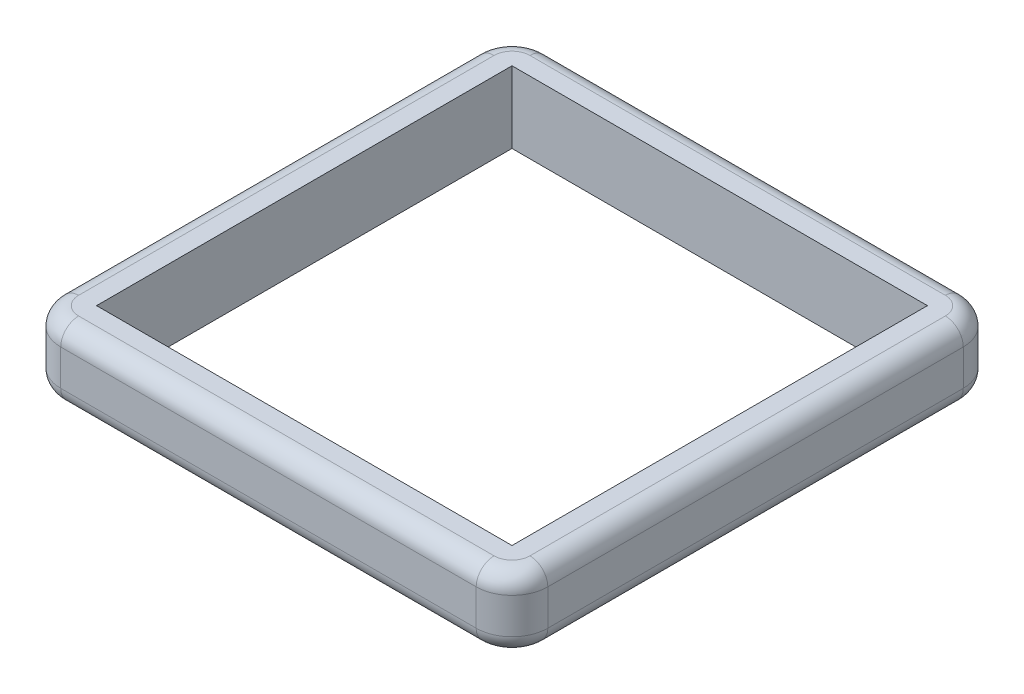
from build123d import *

# Parameters (mm, degrees)
BOSS_EXTRUDE1_DEPTH = 736.6
REVOLVE13_ANGLE     = 90
REVOLVE12_ANGLE     = 90
BOSS_EXTRUDE3_DEPTH = 736.6
REVOLVE2_ANGLE      = 90
BOSS_EXTRUDE4_DEPTH = 736.6
REVOLVE10_ANGLE     = 90
BOSS_EXTRUDE5_DEPTH = 736.6


with BuildPart() as part:
    # Sketch1 → Boss-Extrude1 (new body)
    with BuildSketch(Plane(origin=(0, 0, 0), x_dir=(0, 0, -1), z_dir=(1, 0, 0))):
        with BuildLine():
            ThreePointArc((0, 31.75), (-22.450640303, 22.450640303), (-31.75, 0))
            Line((-31.75, 0), (-31.75, -63.5))
            ThreePointArc((-31.75, -63.5), (-22.450640303, -85.950640303), (0, -95.25))
            Line((0, -95.25), (31.75, -95.25))
            Line((31.75, -95.25), (31.75, 0))
            Line((31.75, 0), (31.75, 31.75))
            Line((31.75, 31.75), (0, 31.75))
        make_face()
    extrude(amount=BOSS_EXTRUDE1_DEPTH)



with BuildPart() as body_2:
    # Sketch8 → Revolve13 (revolve)
    with BuildSketch(Plane(origin=(736.6, 0, 0), x_dir=(0, 0, -1), z_dir=(1, 0, 0))):
        with BuildLine():
            Line((-31.75, 0), (-31.75, -63.5))
            ThreePointArc((-31.75, -63.5), (-22.450640303, -85.950640303), (0, -95.25))
            Line((0, -95.25), (31.75, -95.25))
            Line((31.75, -95.25), (31.75, 31.75))
            Line((31.75, 31.75), (0, 31.75))
            ThreePointArc((0, 31.75), (-22.450640303, 22.450640303), (-31.75, 0))
        make_face()
    revolve(axis=Axis((736.6, -95.25, -31.75), (0, 1, 0)), revolution_arc=REVOLVE13_ANGLE)


with BuildPart() as body_3:
    # Sketch15 → Revolve12 (revolve)
    with BuildSketch(Plane(origin=(0, 0, -31.75), x_dir=(0, 0, 1), z_dir=(-1, 0, 0))):
        with BuildLine():
            ThreePointArc((31.75, -95.25), (54.200640303, -85.950640303), (63.5, -63.5))
            Line((63.5, -63.5), (63.5, 0))
            ThreePointArc((63.5, 0), (54.200640303, 22.450640303), (31.75, 31.75))
            Line((31.75, 31.75), (0, 31.75))
            Line((0, 31.75), (0, -95.25))
            Line((0, -95.25), (31.75, -95.25))
        make_face()
    revolve(axis=Axis((0, 31.75, -31.75), (0, -1, 0)), revolution_arc=REVOLVE12_ANGLE)


with BuildPart() as part_1:
    add(part.part)

    add(body_2.part)  # Boss-Extrude3 merges body 2
    # Sketch7 → Boss-Extrude3 (add)
    with BuildSketch(Plane(origin=(0, 0, -31.75), x_dir=(-1, 0, 0), z_dir=(0, 0, -1))):
        with BuildLine():
            ThreePointArc((-768.35, 31.75), (-790.800640303, 22.450640303), (-800.1, 0))
            Line((-800.1, 0), (-800.1, -63.5))
            ThreePointArc((-800.1, -63.5), (-790.800640303, -85.950640303), (-768.35, -95.25))
            Line((-768.35, -95.25), (-736.6, -95.25))
            Line((-736.6, -95.25), (-736.6, 31.75))
            Line((-736.6, 31.75), (-768.35, 31.75))
        make_face()
    extrude(amount=BOSS_EXTRUDE3_DEPTH)

    # Sketch12 → Revolve2 (revolve)
    with BuildSketch(Plane(origin=(1454.15, 0, -768.35), x_dir=(-1, 0, 0), z_dir=(0, 0, -1))):
        with BuildLine():
            ThreePointArc((685.8, 31.75), (663.349359697, 22.450640303), (654.05, 0))
            Line((654.05, 0), (654.05, -63.5))
            ThreePointArc((654.05, -63.5), (663.349359697, -85.950640303), (685.8, -95.25))
            Line((685.8, -95.25), (717.55, -95.25))
            Line((717.55, -95.25), (717.55, 31.75))
            Line((717.55, 31.75), (685.8, 31.75))
        make_face()
    revolve(axis=Axis((736.6, -95.25, -768.35), (0, 1, 0)), revolution_arc=REVOLVE2_ANGLE)


    add(body_3.part)  # Boss-Extrude4 merges body 3
    # Sketch9 → Boss-Extrude4 (add)
    with BuildSketch(Plane(origin=(0, 0, -31.75), x_dir=(-1, 0, 0), z_dir=(0, 0, -1))):
        with BuildLine():
            Line((0, 31.75), (0, -95.25))
            Line((0, -95.25), (31.75, -95.25))
            ThreePointArc((31.75, -95.25), (54.200640303, -85.950640303), (63.5, -63.5))
            Line((63.5, -63.5), (63.5, 0))
            ThreePointArc((63.5, 0), (54.200640303, 22.450640303), (31.75, 31.75))
            Line((31.75, 31.75), (0, 31.75))
        make_face()
    extrude(amount=BOSS_EXTRUDE4_DEPTH)


with BuildPart() as body_2_2:
    # Sketch14 → Revolve10 (revolve)
    with BuildSketch(Plane(origin=(0, 0, -768.35), x_dir=(-1, 0, 0), z_dir=(0, 0, -1))):
        with BuildLine():
            Line((31.75, 31.75), (0, 31.75))
            Line((0, 31.75), (0, -95.25))
            Line((0, -95.25), (31.75, -95.25))
            ThreePointArc((31.75, -95.25), (54.200640303, -85.950640303), (63.5, -63.5))
            Line((63.5, -63.5), (63.5, 0))
            ThreePointArc((63.5, 0), (54.200640303, 22.450640303), (31.75, 31.75))
        make_face()
    revolve(axis=Axis((0, 31.75, -768.35), (0, -1, 0)), revolution_arc=REVOLVE10_ANGLE)


with BuildPart() as body_3_2:
    # Sketch10 → Boss-Extrude5 (new body)
    with BuildSketch(Plane(origin=(0, 0, 0), x_dir=(0, 0, -1), z_dir=(1, 0, 0))):
        with BuildLine():
            ThreePointArc((831.85, 0), (822.550640303, 22.450640303), (800.1, 31.75))
            Line((800.1, 31.75), (768.35, 31.75))
            Line((768.35, 31.75), (768.35, -95.25))
            Line((768.35, -95.25), (800.1, -95.25))
            ThreePointArc((800.1, -95.25), (822.550640303, -85.950640303), (831.85, -63.5))
            Line((831.85, -63.5), (831.85, 0))
        make_face()
    extrude(amount=BOSS_EXTRUDE5_DEPTH)


with BuildPart() as part_2:
    add(part_1.part)

    # Combine1: union body 3 2, body 2 2
    add(body_3_2.part)
    add(body_2_2.part)


solid = part_2.part
